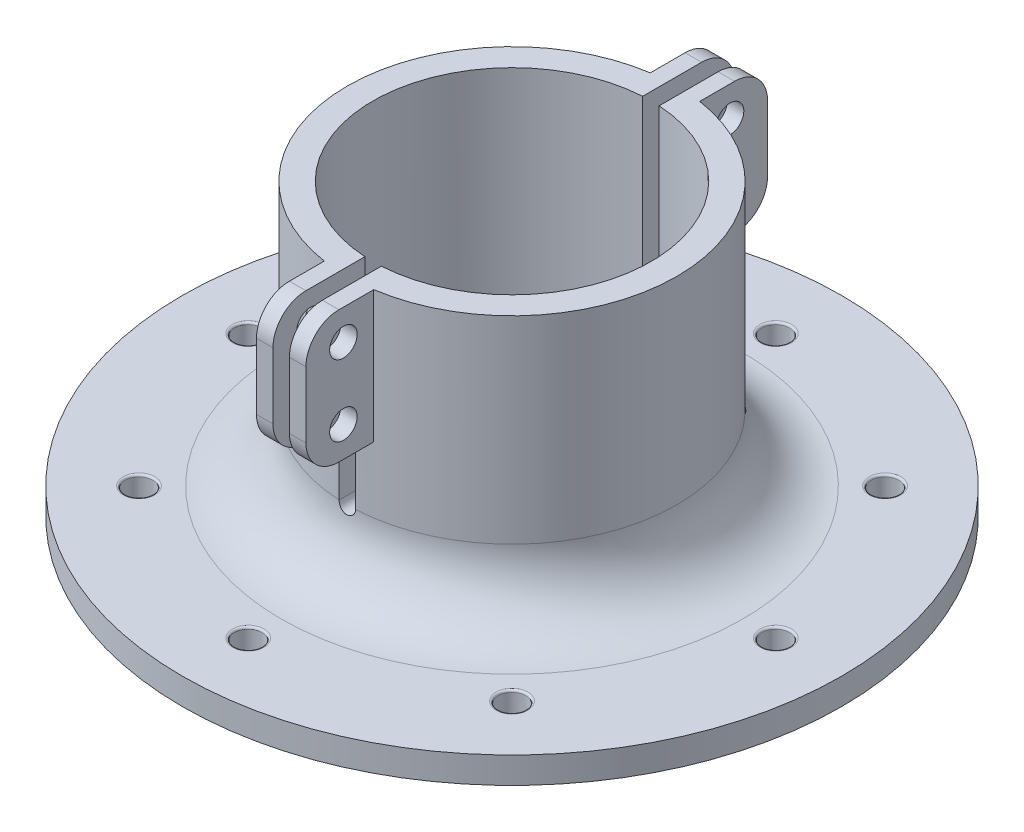
from build123d import *

# Parameters (mm, degrees)
SKETCH1_R                = 63.5
BOSS_EXTRUDE1_DEPTH      = 5.08
SKETCH2_R                = 31.75
SKETCH2_R_2              = 26.797
BOSS_EXTRUDE2_DEPTH      = 50.8
SKETCH3_R                = 26.797
CUT_EXTRUDE1_DEPTH       = 104.175287739
FILLET2_R                = 12.7
FILLET3_R                = 12.7
CUT_EXTRUDE2_DEPTH       = 106.768967266
CUT_EXTRUDE2_DEPTH_BACK  = 106.768967266
SKETCH5_W                = 3.175
SKETCH5_H                = 76.2
SKETCH6_R                = 2.65
CUT_EXTRUDE3_DEPTH       = 104.175287911
CIRPATTERN1_COUNT        = 8
FILLET4_R                = 0.4
BOSS_EXTRUDE3_REACH      = 139.142
BOSS_EXTRUDE3_END_RADIUS = 31.75
SKETCH9_W                = 3.175
SKETCH9_H                = 25.4
FILLET5_R                = 6.35
SKETCH11_R               = 2.65
CUT_EXTRUDE4_DEPTH       = 109.694955466
FILLET5_OF_MIRROR8_R     = 6.35


# Read off the part's stored shape, not the designer's step: Mirror9
with BuildPart() as part:
    # Sketch1 → Boss-Extrude1 (new body)
    with BuildSketch(Plane(origin=(0, 0, 0), x_dir=(1, 0, 0), z_dir=(0, 1, 0))):
        with Locations(Location((0, 0, 0), (0, 0, 270))):
            Circle(SKETCH1_R)
    extrude(amount=BOSS_EXTRUDE1_DEPTH)

    # Sketch2 → Boss-Extrude2 (add)
    with BuildSketch(Plane(origin=(0, 5.08, 0), x_dir=(1, 0, 0), z_dir=(0, 1, 0))):
        with Locations(Location((0, 0, 0), (0, 0, 270))):
            Circle(SKETCH2_R)
        with Locations(Location((0, 0, 0), (0, 0, 270))):
            Circle(SKETCH2_R_2, mode=Mode.SUBTRACT)
    extrude(amount=BOSS_EXTRUDE2_DEPTH)

    # Sketch3 → Cut-Extrude1 (cut, through all)
    with BuildSketch(Plane(origin=(0, 5.08, 0), x_dir=(1, 0, 0), z_dir=(0, 1, 0))):
        with Locations(Location((0, 0, 0), (0, 0, 270))):
            Circle(SKETCH3_R)
    extrude(amount=-CUT_EXTRUDE1_DEPTH, mode=Mode.SUBTRACT)

    # Fillet2
    fillet2_edges = [part.edges().sort_by_distance(p)[0] for p in [
        (0, 5.08, -31.75),
    ]]
    fillet(fillet2_edges, radius=FILLET2_R)

    # Fillet3
    fillet3_edges = [part.edges().sort_by_distance(p)[0] for p in [
        (0, 0, -26.797),
    ]]
    fillet(fillet3_edges, radius=FILLET3_R)

    # Sketch5 → Cut-Extrude2 (cut, two sides: drawn at the far end of the back side and taken through both)
    with BuildSketch(Plane.XY.offset(-CUT_EXTRUDE2_DEPTH_BACK)):
        with Locations((0, 55.88)):
            Rectangle(SKETCH5_W, SKETCH5_H)
        with BuildLine():
            Line((1.5875, 17.78), (-1.5875, 17.78))
            ThreePointArc((-1.5875, 17.78), (0, 16.1925), (1.5875, 17.78))
        make_face()
        with BuildLine():
            ThreePointArc((1.5875, 93.98), (0, 95.5675), (-1.5875, 93.98))
            Line((-1.5875, 93.98), (1.5875, 93.98))
        make_face()
    extrude(amount=CUT_EXTRUDE2_DEPTH + CUT_EXTRUDE2_DEPTH_BACK, mode=Mode.SUBTRACT)

    # Sketch6 → Cut-Extrude3 (cut, symmetric)
    with BuildSketch(Plane(origin=(0, 5.08, 0), x_dir=(1, 0, 0), z_dir=(0, 1, 0))):
        with Locations(Location((50.8, 0, 0), (0, 0, 270))):
            Circle(SKETCH6_R)
    cut_extrude3 = extrude(amount=CUT_EXTRUDE3_DEPTH, both=True, mode=Mode.SUBTRACT)

    # CirPattern1: Cut-Extrude3 ×8 about axis
    cirpattern1_axis = Axis((0, 0, 0), (0, 1, 0))
    for i in range(1, CIRPATTERN1_COUNT):
        add(cut_extrude3.rotate(cirpattern1_axis, i * 360 / CIRPATTERN1_COUNT), mode=Mode.SUBTRACT)

    # Fillet4
    fillet4_edges = [part.edges().sort_by_distance(p)[0] for p in [
        (50.8, 5.08, -2.65),
        (2.65, 5.08, 50.8),
        (-34.047191514, 5.08, 37.794857454),
        (-50.8, 5.08, 2.65),
        (-37.794857454, 5.08, -34.047191514),
        (-2.65, 5.08, -50.8),
        (34.047191514, 5.08, -37.794857454),
        (37.794857454, 5.08, 34.047191514),
    ]]
    fillet(fillet4_edges, radius=FILLET4_R)

    # Boss-Extrude3: up to this cylinder (the profile starts outside it)
    boss_extrude3_end = Plane(origin=(0, 43.18, 0), z_dir=(0, -1, 0)) * Cylinder(BOSS_EXTRUDE3_END_RADIUS, 342.784, mode=Mode.PRIVATE)
    # Sketch9 → Boss-Extrude3 (add, up to the surface)
    with BuildSketch(Plane.XY.offset(44.45), mode=Mode.PRIVATE) as boss_extrude3_sk1:
        with Locations((3.175, 43.18)):
            Rectangle(SKETCH9_W, SKETCH9_H)
    boss_extrude3_tool1 = extrude(boss_extrude3_sk1.sketch, amount=-BOSS_EXTRUDE3_REACH, mode=Mode.PRIVATE) - boss_extrude3_end
    boss_extrude3 = boss_extrude3_tool1.solids().sort_by_distance((3.175, 43.18, 44.45))[0]
    add(boss_extrude3)

    # Fillet5
    fillet5_edges = [part.edges().sort_by_distance(p)[0] for p in [
        (3.175, 30.48, 44.45),
        (3.175, 55.88, 44.45),
    ]]
    fillet(fillet5_edges, radius=FILLET5_R)

    # Sketch11 → Cut-Extrude4 (cut, through all)
    with BuildSketch(Plane(origin=(4.7625, 0, 0), x_dir=(0, 0, -1), z_dir=(1, 0, 0))):
        with Locations(Location((-37.232780394, 50.038, 0), (0, 0, 90))):
            Circle(SKETCH11_R)
        with Locations(Location((-37.232780394, 36.322, 0), (0, 0, 90))):
            Circle(SKETCH11_R)
    cut_extrude4 = extrude(amount=-CUT_EXTRUDE4_DEPTH, mode=Mode.SUBTRACT)

    # Mirror8: Boss-Extrude3, Cut-Extrude4 across plane
    add(boss_extrude3.mirror(Plane.XY))
    add(cut_extrude4.mirror(Plane.XY), mode=Mode.SUBTRACT)

    # Fillet5 of Mirror8
    fillet5_of_mirror8_edges = [part.edges().sort_by_distance(p)[0] for p in [
        (3.175, 30.48, -44.45),
        (3.175, 55.88, -44.45),
    ]]
    fillet(fillet5_of_mirror8_edges, radius=FILLET5_OF_MIRROR8_R)

    # Mirror9: part across plane


with BuildPart() as part_1:
    add(part.part)
    add(part.part.mirror(Plane(origin=(0, 0, 0), x_dir=(0, 0, 1), z_dir=(1, 0, 0))))


solid = part_1.part
